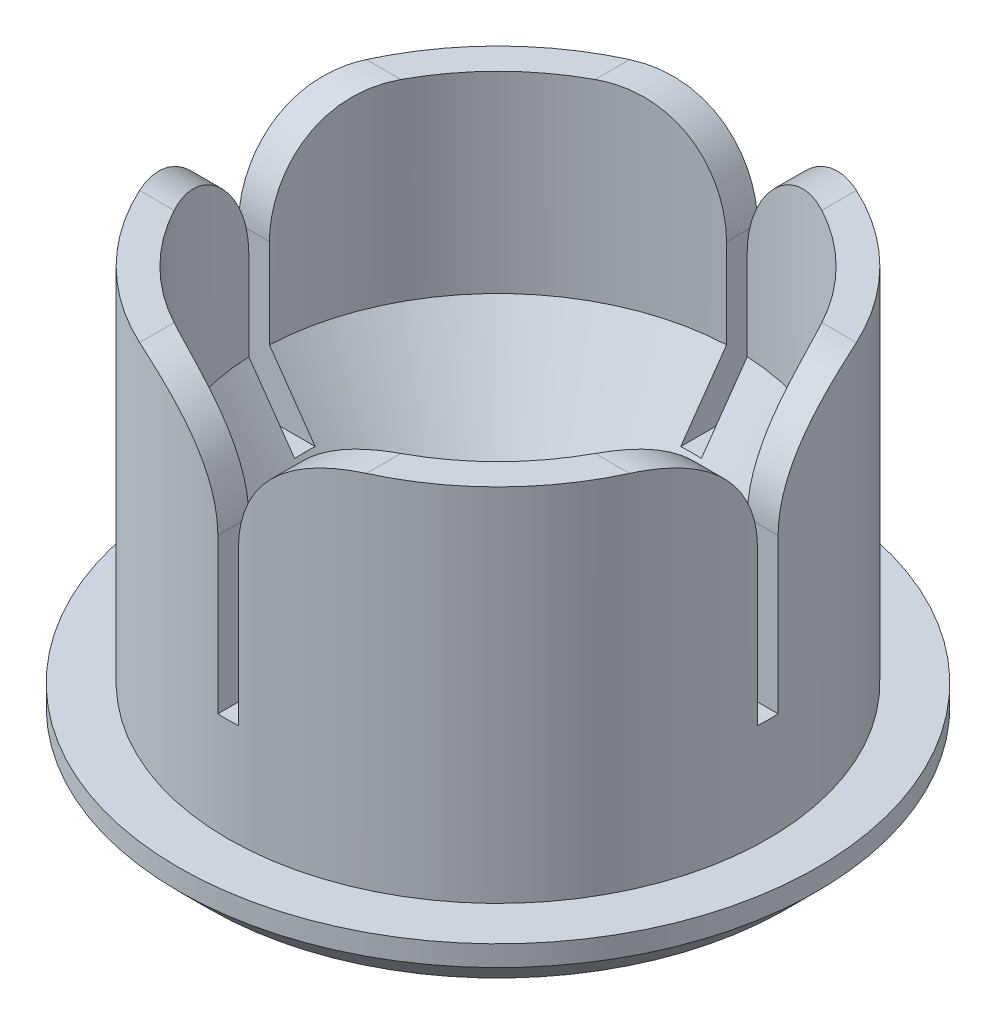
from build123d import *

# Parameters (mm, degrees)
SKETCH1_R               = 15.25
SKETCH1_R_2             = 12.75
BOSS_EXTRUDE1_DEPTH     = 4
SKETCH2_R               = 15.25
SKETCH2_R_2             = 7.5
BOSS_EXTRUDE2_DEPTH     = 6
BOSS_EXTRUDE3_START     = -3
SKETCH3_R               = 15.25
BOSS_EXTRUDE3_DEPTH     = 3
SKETCH4_R               = 1.25
CUT_EXTRUDE1_DEPTH      = 10
CUT_EXTRUDE_THIN1_START = -70
CUT_EXTRUDE_THIN1_DEPTH = 25
SKETCH7_R               = 31
SKETCH7_R_2             = 26
BOSS_EXTRUDE4_DEPTH     = 5
CHAMFER3_SIZE           = 3
FILLET3_R               = 1
FILLET4_R               = 10


with BuildPart() as part:
    # Sketch1 → Boss-Extrude1 (new body)
    with BuildSketch(Plane(origin=(0, 0, 0), x_dir=(1, 0, 0), z_dir=(0, 1, 0))):
        with Locations(Location((0, 0, 0), (0, 0, 270))):
            Circle(SKETCH1_R)
        with Locations(Location((0, 0, 0), (0, 0, 270))):
            Circle(SKETCH1_R_2, mode=Mode.SUBTRACT)
    extrude(amount=BOSS_EXTRUDE1_DEPTH)

    # Sketch2 → Boss-Extrude2 (add)
    with BuildSketch(Plane(origin=(0, 4, 0), x_dir=(1, 0, 0), z_dir=(0, 1, 0))):
        with Locations(Location((0, 0, 0), (0, 0, 270))):
            Circle(SKETCH2_R)
        with Locations(Location((0, 0, 0), (0, 0, 270))):
            Circle(SKETCH2_R_2, mode=Mode.SUBTRACT)
    extrude(amount=BOSS_EXTRUDE2_DEPTH)

    # Sketch3 → Boss-Extrude3 (add)
    with BuildSketch(Plane(origin=(0, 10, 0), x_dir=(1, 0, 0), z_dir=(0, 1, 0)).offset(BOSS_EXTRUDE3_START)):
        with Locations(Location((0, 0, 0), (0, 0, 270))):
            Circle(SKETCH3_R)
    extrude(amount=BOSS_EXTRUDE3_DEPTH)

    # Sketch4 → Cut-Extrude1 (cut)
    with BuildSketch(Plane(origin=(0, 4, 0), x_dir=(-1, 0, 0), z_dir=(0, -1, 0))):
        with Locations(Location((5.42938356, -8.987312955, 0), (0, 0, 90))):
            Circle(SKETCH4_R)
        with Locations(Location((-5.068549551, -9.195640568, 0), (0, 0, 90))):
            Circle(SKETCH4_R)
        with Locations(Location((-10.497933111, -0.208327612, 0), (0, 0, 90))):
            Circle(SKETCH4_R)
        with Locations(Location((-5.42938356, 8.987312955, 0), (0, 0, 90))):
            Circle(SKETCH4_R)
        with Locations(Location((5.068549551, 9.195640568, 0), (0, 0, 90))):
            Circle(SKETCH4_R)
        with Locations(Location((10.497933111, 0.208327612, 0), (0, 0, 90))):
            Circle(SKETCH4_R)
    extrude(amount=-CUT_EXTRUDE1_DEPTH, mode=Mode.SUBTRACT)

    # Sketch5 → Revolve1 (revolve)
    with BuildSketch(Plane.XY, mode=Mode.PRIVATE) as revolve1_sk:
        Polygon((-15.25, 0), (-26.2, 0), (-26.2, 20), (-26.2, 40), (-23.2, 40), (-23.2, 21.323043804), (-15.25, 10), align=None)
    revolve(revolve1_sk.sketch.rotate(Axis((0, 0, 0), (0, 1, 0)), 270), axis=Axis((0, 0, 0), (0, 1, 0)))

    # Cut-Extrude-Thin1: read off the stored shape, not the designer's step
    # Cut-Extrude-Thin1 outline → Cut-Extrude-Thin1 (cut)
    with BuildSketch(Plane(origin=(0, 85, 0), x_dir=(1, 0, 0), z_dir=(0, 1, 0)).offset(CUT_EXTRUDE_THIN1_START)):
        with BuildLine():
            Line((1, 1), (1, 26.180909075))
            ThreePointArc((1, 26.180909075), (0, 26.2), (-1, 26.180909075))
            Line((-1, 26.180909075), (-1, 1))
            Line((-1, 1), (1, 1))
        make_face()
        with BuildLine():
            Line((1, 1), (1, -1))
            Line((1, -1), (26.180909075, -1))
            ThreePointArc((26.180909075, -1), (26.2, 0), (26.180909075, 1))
            Line((26.180909075, 1), (1, 1))
        make_face()
        with BuildLine():
            Line((1, -1), (-1, -1))
            Line((-1, -1), (-1, -26.180909075))
            ThreePointArc((-1, -26.180909075), (0, -26.2), (1, -26.180909075))
            Line((1, -26.180909075), (1, -1))
        make_face()
        with BuildLine():
            Line((-1, -1), (-1, 1))
            Line((-1, 1), (-26.180909075, 1))
            ThreePointArc((-26.180909075, 1), (-26.2, 0), (-26.180909075, -1))
            Line((-26.180909075, -1), (-1, -1))
        make_face()
    extrude(amount=CUT_EXTRUDE_THIN1_DEPTH, mode=Mode.SUBTRACT)

    # Sketch7 → Boss-Extrude4 (add)
    with BuildSketch(Plane(origin=(0, 0, 0), x_dir=(-1, 0, 0), z_dir=(0, -1, 0))):
        with Locations(Location((0, 0, 0), (0, 0, 90))):
            Circle(SKETCH7_R)
        Circle(SKETCH7_R_2, mode=Mode.SUBTRACT)
    extrude(amount=-BOSS_EXTRUDE4_DEPTH)

    # Chamfer3
    chamfer3_edges = [part.edges().sort_by_distance(p)[0] for p in [
        (0, 0, 31),
    ]]
    chamfer(chamfer3_edges, length=CHAMFER3_SIZE)

    # Fillet3
    fillet3_edges = [part.edges().sort_by_distance(p)[0] for p in [
        (0, 0, -12.75),
    ]]
    fillet(fillet3_edges, radius=FILLET3_R)

    # Fillet4
    fillet4_edges = [part.edges().sort_by_distance(p)[0] for p in [
        (24.679673666, 40, 1),
        (-24.679673666, 40, -1),
        (-1, 40, 24.679673666),
        (1, 40, -24.679673666),
        (24.679673666, 40, -1),
        (-24.679673666, 40, 1),
        (1, 40, 24.679673666),
        (-1, 40, -24.679673666),
    ]]
    fillet(fillet4_edges, radius=FILLET4_R)


solid = part.part
